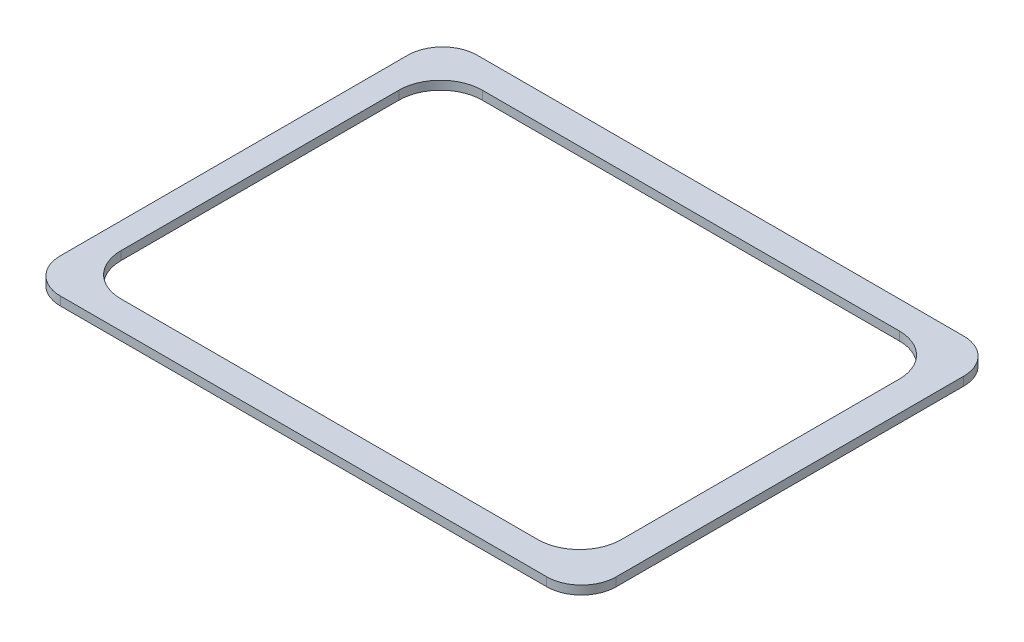
from build123d import *

# Parameters (mm, degrees)
FRONTFACE_DEPTH = 3.175


with BuildPart() as part:
    # Sketch1 → FrontFace (new body)
    with BuildSketch(Plane(origin=(0, 7.14375, 0), x_dir=(-1, 0, 0), z_dir=(0, 1, 0))):
        with BuildLine():
            Line((-101.6, 63.5), (-101.6, -63.5))
            ThreePointArc((-101.6, -63.5), (-97.880256121, -72.480256121), (-88.9, -76.2))
            Line((-88.9, -76.2), (88.9, -76.2))
            ThreePointArc((88.9, -76.2), (97.880256121, -72.480256121), (101.6, -63.5))
            Line((101.6, -63.5), (101.6, 63.5))
            ThreePointArc((101.6, 63.5), (97.880256121, 72.480256121), (88.9, 76.2))
            Line((88.9, 76.2), (-88.9, 76.2))
            ThreePointArc((-88.9, 76.2), (-97.880256121, 72.480256121), (-101.6, 63.5))
        make_face()
        with BuildLine():
            Line((-90.75, 50.8), (-90.75, 0))
            Line((-90.75, 0), (-90.75, -50.8))
            ThreePointArc((-90.75, -50.8), (-86.283378413, -61.583378413), (-75.5, -66.05))
            Line((-75.5, -66.05), (76.9, -66.05))
            ThreePointArc((76.9, -66.05), (87.683378413, -61.583378413), (92.15, -50.8))
            Line((92.15, -50.8), (92.15, 50.8))
            ThreePointArc((92.15, 50.8), (87.683378413, 61.583378413), (76.9, 66.05))
            Line((76.9, 66.05), (-75.5, 66.05))
            ThreePointArc((-75.5, 66.05), (-86.283378413, 61.583378413), (-90.75, 50.8))
        make_face(mode=Mode.SUBTRACT)
    extrude(amount=FRONTFACE_DEPTH)


solid = part.part
